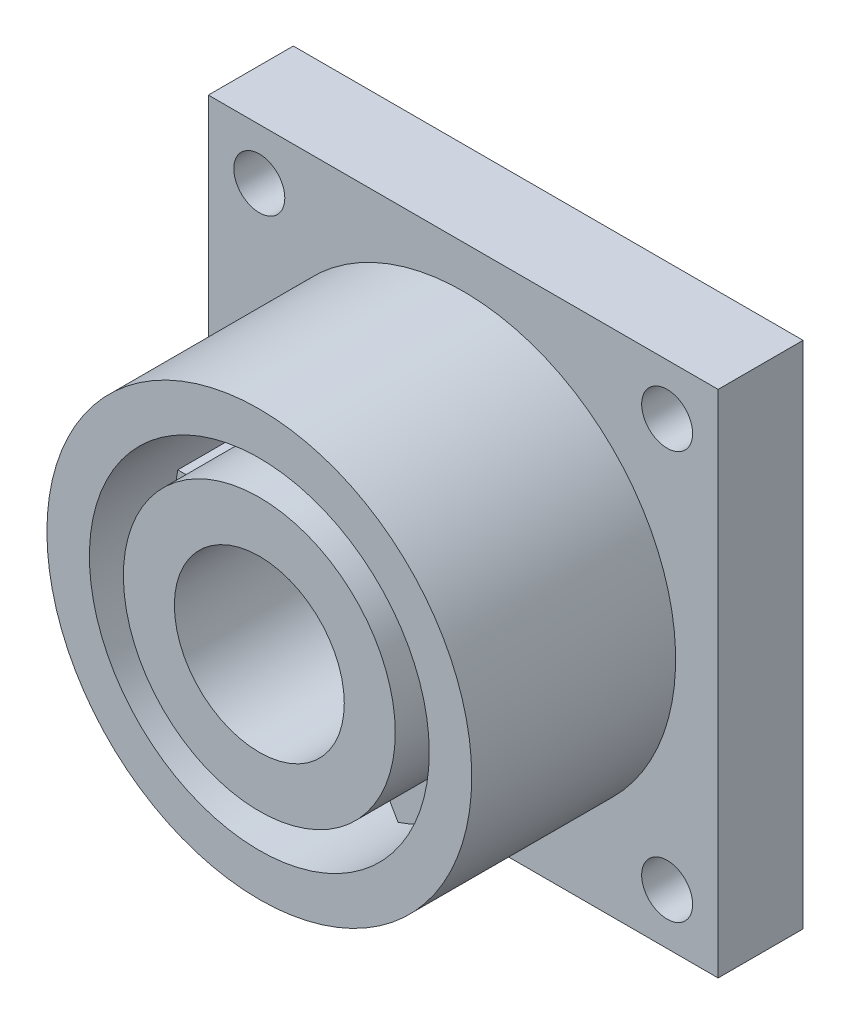
from build123d import *
from build123d.topology import SkipClean

# Parameters (mm, degrees)
CROQUIS1_W              = 30
CROQUIS1_H              = 30
CROQUIS1_R              = 1.5
SALIENTE_EXTRUIR1_DEPTH = 2.5
CROQUIS2_R              = 12.5
CROQUIS2_R_2            = 5
SALIENTE_EXTRUIR2_DEPTH = 7
CROQUIS4_R              = 12.5
CROQUIS4_R_2            = 10
CROQUIS4_R_3            = 8
CROQUIS4_R_4            = 5
SALIENTE_EXTRUIR3_DEPTH = 5


with BuildPart() as part:
    # Croquis1 → Saliente-Extruir1 (new, symmetric)
    with BuildSketch(Plane.XY):
        Rectangle(CROQUIS1_W, CROQUIS1_H)
        with Locations((-12, 12)):
            Circle(CROQUIS1_R, mode=Mode.SUBTRACT)
        with Locations((12, 12)):
            Circle(CROQUIS1_R, mode=Mode.SUBTRACT)
        with Locations((12, -12)):
            Circle(CROQUIS1_R, mode=Mode.SUBTRACT)
        with Locations((-12, -12)):
            Circle(CROQUIS1_R, mode=Mode.SUBTRACT)
    extrude(amount=SALIENTE_EXTRUIR1_DEPTH, both=True)

    # Croquis2 → Saliente-Extruir2 (add)
    with BuildSketch(Plane.XY.offset(2.5)):
        Circle(CROQUIS2_R)
        with BuildLine():
            Line((-7.745966692, 2), (-9.797958971, 2))
            ThreePointArc((-9.797958971, 2), (-8.660254038, 5), (-6.631030293, 7.485281374))
            Line((-6.631030293, 7.485281374), (-5.605034154, 5.708203932))
            ThreePointArc((-5.605034154, 5.708203932), (-6.92820323, 4), (-7.745966692, 2))
        make_face(mode=Mode.SUBTRACT)
        with BuildLine():
            Line((-9.797958971, -2), (-7.745966692, -2))
            ThreePointArc((-7.745966692, -2), (-6.92820323, -4), (-5.605034154, -5.708203932))
            Line((-5.605034154, -5.708203932), (-6.631030293, -7.485281374))
            ThreePointArc((-6.631030293, -7.485281374), (-8.660254038, -5), (-9.797958971, -2))
        make_face(mode=Mode.SUBTRACT)
        with BuildLine():
            ThreePointArc((3.166928678, -9.485281374), (0, -10), (-3.166928678, -9.485281374))
            Line((-3.166928678, -9.485281374), (-2.140932539, -7.708203932))
            ThreePointArc((-2.140932539, -7.708203932), (0, -8), (2.140932539, -7.708203932))
            Line((2.140932539, -7.708203932), (3.166928678, -9.485281374))
        make_face(mode=Mode.SUBTRACT)
        with BuildLine():
            ThreePointArc((9.797958971, -2), (8.660254038, -5), (6.631030293, -7.485281374))
            Line((6.631030293, -7.485281374), (5.605034154, -5.708203933))
            ThreePointArc((5.605034154, -5.708203933), (6.92820323, -4), (7.745966692, -2))
            Line((7.745966692, -2), (9.797958971, -2))
        make_face(mode=Mode.SUBTRACT)
        with BuildLine():
            ThreePointArc((6.631030293, 7.485281374), (8.660254038, 5), (9.797958971, 2))
            Line((9.797958971, 2), (7.745966692, 2))
            ThreePointArc((7.745966692, 2), (6.92820323, 4), (5.605034154, 5.708203932))
            Line((5.605034154, 5.708203932), (6.631030293, 7.485281374))
        make_face(mode=Mode.SUBTRACT)
        with BuildLine():
            ThreePointArc((-3.166928678, 9.485281374), (0, 10), (3.166928678, 9.485281374))
            Line((3.166928678, 9.485281374), (2.140932539, 7.708203932))
            ThreePointArc((2.140932539, 7.708203932), (0, 8), (-2.140932539, 7.708203932))
            Line((-2.140932539, 7.708203932), (-3.166928678, 9.485281374))
        make_face(mode=Mode.SUBTRACT)
        Circle(CROQUIS2_R_2, mode=Mode.SUBTRACT)
    extrude(amount=SALIENTE_EXTRUIR2_DEPTH)

    # Croquis4 → Saliente-Extruir3 (add)
    # profile 1 of 2: a face of its own
    with SkipClean():  # the faces are left unmerged after this step: merging them gives an invalid solid
        with BuildSketch(Plane.XY.offset(9.5)):
            Circle(CROQUIS4_R)
            Circle(CROQUIS4_R_2, mode=Mode.SUBTRACT)
        # profile 2 of 2: a face of its own
        with BuildSketch(Plane.XY.offset(9.5)):
            Circle(CROQUIS4_R_3)
            Circle(CROQUIS4_R_4, mode=Mode.SUBTRACT)
        extrude(amount=SALIENTE_EXTRUIR3_DEPTH)


solid = part.part
